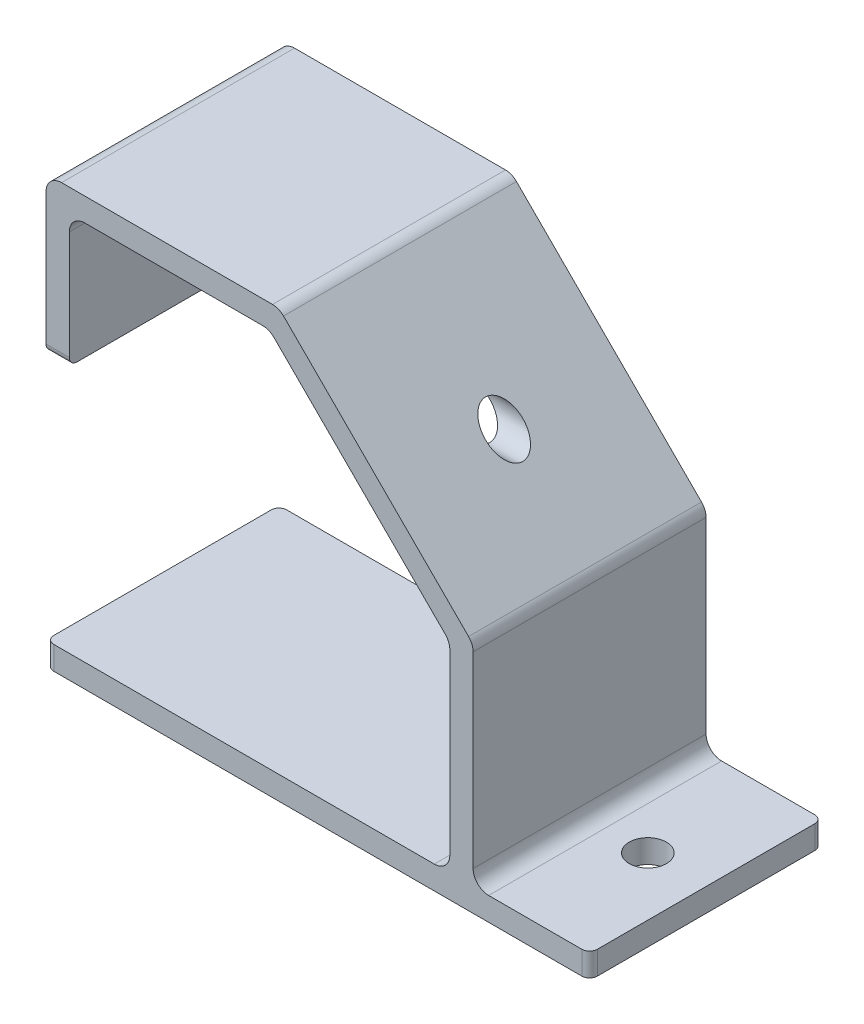
from build123d import *

# Parameters (mm, degrees)
EXTRUDE_THIN1_DEPTH  = 30
M4_CLEARANCE_HOLE1_D = 4.8
M4_CLEARANCE_HOLE2_D = 4.8
FILLET1_R            = 1
FILLET2_R            = 2


# Read off the part's stored shape, not the designer's step: Extrude-Thin1
with BuildPart() as part:
    # Extrude-Thin1 outline → Extrude-Thin1 (new body)
    with BuildSketch(Plane.XY):
        Polygon((0, 3), (0, 0), (70, 0), (70, 3), (55, 3), (55, 30), (30, 55), (0, 55), (0, 35), (3, 35), (3, 52), (28.757359313, 52), (52, 28.757359313), (52, 3), align=None)
    extrude(amount=EXTRUDE_THIN1_DEPTH)

    # M4 Clearance Hole1 (through all)
    with Locations(Plane.ZY):
        with Locations((15, 41)):
            Hole(M4_CLEARANCE_HOLE1_D / 2)

    # M4 Clearance Hole2 (through all)
    with Locations(Plane(origin=(0, 3, 0), x_dir=(1, 0, 0), z_dir=(0, 1, 0))):
        with Locations((62.5, -15)):
            Hole(M4_CLEARANCE_HOLE2_D / 2)

    # Fillet1
    fillet1_edges = [part.edges().sort_by_distance(p)[0] for p in [
        (1.5, 35, 0),
        (1.5, 35, 30),
        (0, 1.5, 0),
        (0, 1.5, 30),
        (70, 1.5, 0),
        (70, 1.5, 30),
    ]]
    fillet(fillet1_edges, radius=FILLET1_R)

    # Fillet2
    fillet2_edges = [part.edges().sort_by_distance(p)[0] for p in [
        (0, 55, 15),
        (30, 55, 15),
        (55, 30, 15),
        (52, 28.757359313, 15),
        (28.757359313, 52, 15),
        (3, 52, 15),
        (55, 3, 15),
        (52, 3, 15),
    ]]
    fillet(fillet2_edges, radius=FILLET2_R)


solid = part.part
